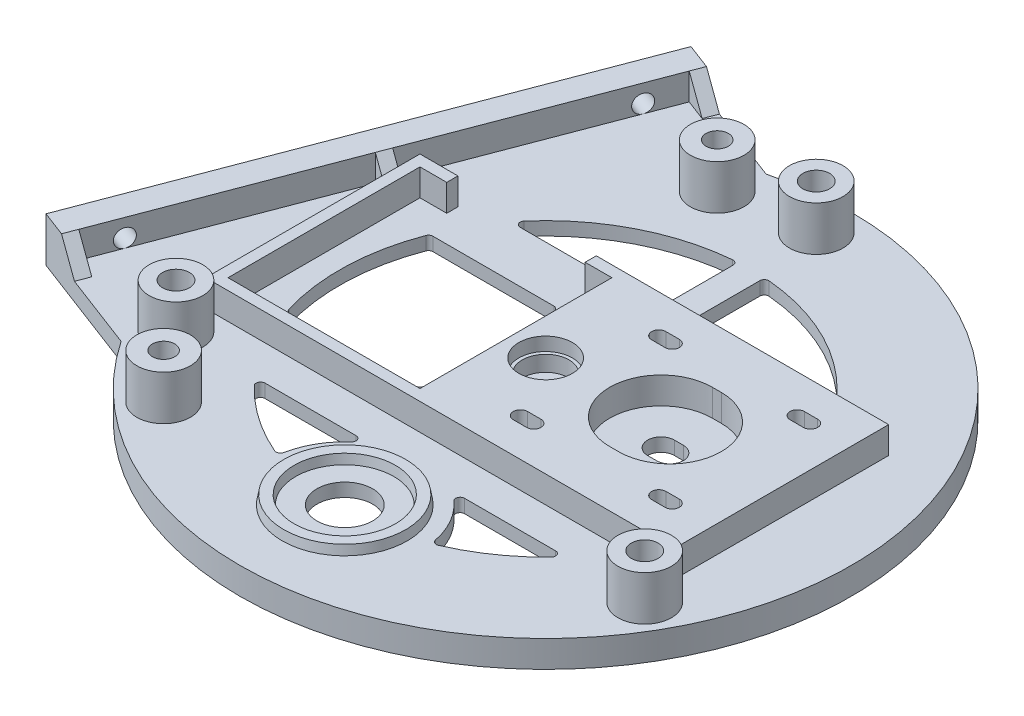
from build123d import *

# Parameters (mm, degrees)
SKETCH2_R           = 6
SKETCH2_R_2         = 3
SKETCH2_R_3         = 2.5
BOSS_EXTRUDE1_DEPTH = 10
SKETCH3_R           = 6.25
CUT_EXTRUDE1_DEPTH  = 10
BOSS_EXTRUDE5_START = -4
BOSS_EXTRUDE5_DEPTH = 4
SKETCH4_R           = 14
SKETCH4_R_2         = 11
BOSS_EXTRUDE2_DEPTH = 2
BOSS_EXTRUDE2_DRAFT = 10
BOSS_EXTRUDE3_DEPTH = 6
CUT_EXTRUDE2_DEPTH  = 115.547023297
CUT_EXTRUDE3_DEPTH  = 115.127212119
SKETCH8_R           = 1.75
CUT_EXTRUDE4_DEPTH  = 115.547023297
CHAMFER1_SIZE       = 2
SKETCH9_R           = 5.25
CUT_EXTRUDE5_DEPTH  = 6.5
SKETCH10_R          = 6
CUT_EXTRUDE6_DEPTH  = 3
CUT_EXTRUDE7_DEPTH  = 115.127212119
SKETCH13_R          = 2
CUT_EXTRUDE8_DEPTH  = 10
RIB1_REACH          = 158.729
SKETCH15_WALL_W     = 323.267375012
SKETCH15_WALL_H     = 3
LPATTERN1_COUNT     = 3
LPATTERN1_PITCH     = 54.5


with BuildPart() as part:
    # Sketch1 → Revolve1 (revolve)
    with BuildSketch(Plane.XY):
        with BuildLine():
            Line((0, 0), (68.5, 0))
            Line((68.5, 0), (68.5, -6))
            Line((68.5, -6), (66.5, -6))
            Line((66.5, -6), (66.5, -3))
            Line((66.5, -3), (62.351595203, -3))
            ThreePointArc((62.351595203, -3), (60, -2.3), (57.648404797, -3))
            Line((57.648404797, -3), (53.5, -3))
            Line((53.5, -3), (53.5, -6))
            Line((53.5, -6), (50.5, -6))
            Line((50.5, -6), (50.5, -3))
            Line((50.5, -3), (8, -3))
            Line((8, -3), (8, -8))
            Line((8, -8), (0, -8))
            Line((0, -8), (0, 0))
        make_face()
    revolve(axis=Axis((0, -8, 0), (0, 1, 0)))

    # Sketch2 → Boss-Extrude1 (add)
    # profile 1 of 5: a face of its own
    with BuildSketch(Plane(origin=(0, 0, 0), x_dir=(1, 0, 0), z_dir=(0, 1, 0))):
        with Locations((0, 60.621778265)):
            Circle(SKETCH2_R)
        with Locations((0, 60.621778265)):
            Circle(SKETCH2_R_2, mode=Mode.SUBTRACT)
    # profile 2 of 5: a face of its own
    with BuildSketch(Plane(origin=(0, 0, 0), x_dir=(1, 0, 0), z_dir=(0, 1, 0))):
        with Locations((52.5, -30.310889132)):
            Circle(SKETCH2_R)
        with Locations((52.5, -30.310889132)):
            Circle(SKETCH2_R_2, mode=Mode.SUBTRACT)
    # profile 3 of 5: a face of its own
    with BuildSketch(Plane(origin=(0, 0, 0), x_dir=(1, 0, 0), z_dir=(0, 1, 0))):
        with Locations((-52.5, -30.310889132)):
            Circle(SKETCH2_R)
        with Locations((-52.5, -30.310889132)):
            Circle(SKETCH2_R_2, mode=Mode.SUBTRACT)
    # profile 4 of 5: a face of its own
    with BuildSketch(Plane(origin=(0, 0, 0), x_dir=(1, 0, 0), z_dir=(0, 1, 0))):
        with Locations((-40.273109217, -45.310889132)):
            Circle(SKETCH2_R)
        with Locations((-40.273109217, -45.310889132)):
            Circle(SKETCH2_R_3, mode=Mode.SUBTRACT)
    # profile 5 of 5: a face of its own
    with BuildSketch(Plane(origin=(0, 0, 0), x_dir=(1, 0, 0), z_dir=(0, 1, 0))):
        with Locations((-19.103826448, 57.532980238)):
            Circle(SKETCH2_R)
        with Locations((-19.103826448, 57.532980238)):
            Circle(SKETCH2_R_3, mode=Mode.SUBTRACT)
    extrude(amount=BOSS_EXTRUDE1_DEPTH)

    # Sketch3 → Cut-Extrude1 (cut)
    with BuildSketch(Plane(origin=(0, 0, 0), x_dir=(1, 0, 0), z_dir=(0, 1, 0))):
        with Locations((0, -45)):
            Circle(SKETCH3_R)
    extrude(amount=-CUT_EXTRUDE1_DEPTH, mode=Mode.SUBTRACT)

    # Sketch12 → Boss-Extrude5 (add)
    with BuildSketch(Plane(origin=(0, 0, 0), x_dir=(1, 0, 0), z_dir=(0, 1, 0)).offset(BOSS_EXTRUDE5_START)):
        with BuildLine():
            Line((-44.128655451, 76.68710301), (-64.028922594, 24.342289775))
            ThreePointArc((-64.028922594, 24.342289775), (-45.626994481, 51.092341643), (-16.974162066, 66.363603143))
            Line((-16.974162066, 66.363603143), (-44.128655451, 76.68710301))
        make_face()
        with BuildLine():
            Line((-83.92918907, -28.002521708), (-56.774695686, -38.326021575))
            ThreePointArc((-56.774695686, -38.326021575), (-68.045630714, -7.876683361), (-64.028922594, 24.342289775))
            Line((-64.028922594, 24.342289775), (-83.92918907, -28.002521708))
        make_face()
    extrude(amount=BOSS_EXTRUDE5_DEPTH)


with BuildPart() as boss_extrude2_tool:
    # Sketch4 → Boss-Extrude2 (with draft: the straight prism first)
    with BuildSketch(Plane(origin=(0, 0, 0), x_dir=(1, 0, 0), z_dir=(0, 1, 0))):
        with Locations((0, -45)):
            Circle(SKETCH4_R)
        with Locations((0, -45)):
            Circle(SKETCH4_R_2, mode=Mode.SUBTRACT)
    extrude(amount=BOSS_EXTRUDE2_DEPTH)
    # Boss-Extrude2: the draft: its side faces are tilted about the plane it starts from
    boss_extrude2_sides = [boss_extrude2_tool.faces().sort_by_distance(p)[0] for p in [
        (-14, 1, 45),
        (-11, 1, 45),
    ]]
    draft(boss_extrude2_sides, Plane(origin=(0, 0, 0), x_dir=(1, 0, 0), z_dir=(0, 1, 0)), BOSS_EXTRUDE2_DRAFT)


with BuildPart() as part_1:
    add(part.part)

    # Boss-Extrude2: add boss_extrude2_tool
    add(boss_extrude2_tool.part)

    # Sketch5 → Boss-Extrude3 (add)
    # profile 1 of 2: a face of its own
    with BuildSketch(Plane(origin=(0, 0, 0), x_dir=(1, 0, 0), z_dir=(0, 1, 0))):
        Polygon((51.356277967, -22.510312898), (51.356277967, 25.489687102), (-14.143722033, 25.489687102), (-14.143722033, 22.989687102), (-8.143722033, 22.989687102), (-8.143722033, -20.010312898), (-51.143722033, -20.010312898), (-51.143722033, 22.989687102), (-45.143722033, 22.989687102), (-45.143722033, 25.489687102), (-53.643722033, 25.489687102), (-53.643722033, -22.510312898), align=None)
        with BuildLine():
            Line((26.356277967, -10.010312898), (24.356277967, -10.010312898))
            ThreePointArc((24.356277967, -10.010312898), (12.856277967, 1.489687102), (24.356277967, 12.989687102))
            Line((24.356277967, 12.989687102), (26.356277967, 12.989687102))
            ThreePointArc((26.356277967, 12.989687102), (37.856277967, 1.489687102), (26.356277967, -10.010312898))
        make_face(mode=Mode.SUBTRACT)
    # profile 2 of 2: a face of its own
    with BuildSketch(Plane(origin=(0, 0, 0), x_dir=(1, 0, 0), z_dir=(0, 1, 0))):
        Polygon((-38.520282698, 74.554931566), (-78.320816318, -30.134693152), (-83.92918907, -28.002521708), (-44.128655451, 76.68710301), align=None)
    extrude(amount=BOSS_EXTRUDE3_DEPTH)

    # Sketch6 → Cut-Extrude2 (cut, through all)
    with BuildSketch(Plane(origin=(0, 6, 0), x_dir=(1, 0, 0), z_dir=(0, 1, 0))):
        with BuildLine():
            Line((11.356277967, -15.610312898), (8.356277967, -15.610312898))
            ThreePointArc((8.356277967, -15.610312898), (6.756277967, -14.010312898), (8.356277967, -12.410312898))
            Line((8.356277967, -12.410312898), (11.356277967, -12.410312898))
            ThreePointArc((11.356277967, -12.410312898), (12.956277967, -14.010312898), (11.356277967, -15.610312898))
        make_face()
        with BuildLine():
            Line((42.356277967, -15.610312898), (39.356277967, -15.610312898))
            ThreePointArc((39.356277967, -15.610312898), (37.756277967, -14.010312898), (39.356277967, -12.410312898))
            Line((39.356277967, -12.410312898), (42.356277967, -12.410312898))
            ThreePointArc((42.356277967, -12.410312898), (43.956277967, -14.010312898), (42.356277967, -15.610312898))
        make_face()
        with BuildLine():
            Line((42.356277967, 15.389687102), (39.356277967, 15.389687102))
            ThreePointArc((39.356277967, 15.389687102), (37.756277967, 16.989687102), (39.356277967, 18.589687102))
            Line((39.356277967, 18.589687102), (42.356277967, 18.589687102))
            ThreePointArc((42.356277967, 18.589687102), (43.956277967, 16.989687102), (42.356277967, 15.389687102))
        make_face()
        with BuildLine():
            Line((11.356277967, 15.389687102), (8.356277967, 15.389687102))
            ThreePointArc((8.356277967, 15.389687102), (6.756277967, 16.989687102), (8.356277967, 18.589687102))
            Line((8.356277967, 18.589687102), (11.356277967, 18.589687102))
            ThreePointArc((11.356277967, 18.589687102), (12.956277967, 16.989687102), (11.356277967, 15.389687102))
        make_face()
    extrude(amount=-CUT_EXTRUDE2_DEPTH, mode=Mode.SUBTRACT)

    # Sketch7 → Cut-Extrude3 (cut, through all)
    with BuildSketch(Plane(origin=(0, 0, 0), x_dir=(1, 0, 0), z_dir=(0, 1, 0))):
        with BuildLine():
            Line((26.356277967, -1.510312898), (24.356277967, -1.510312898))
            ThreePointArc((24.356277967, -1.510312898), (21.356277967, 1.489687102), (24.356277967, 4.489687102))
            Line((24.356277967, 4.489687102), (26.356277967, 4.489687102))
            ThreePointArc((26.356277967, 4.489687102), (29.356277967, 1.489687102), (26.356277967, -1.510312898))
        make_face()
    extrude(amount=-CUT_EXTRUDE3_DEPTH, mode=Mode.SUBTRACT)

    # Sketch8 → Cut-Extrude4 (cut, through all)
    with BuildSketch(Plane(origin=(0, 6, 0), x_dir=(1, 0, 0), z_dir=(0, 1, 0))):
        Circle(SKETCH8_R)
    extrude(amount=-CUT_EXTRUDE4_DEPTH, mode=Mode.SUBTRACT)

    # Chamfer1
    chamfer1_edges = [part_1.edges().sort_by_distance(p)[0] for p in [
        (37.756277967, -3, 14.010312898),
        (40.856277967, -3, 12.410312898),
        (40.856277967, -3, 15.610312898),
        (43.956277967, -3, 14.010312898),
        (37.756277967, -3, -16.989687102),
        (40.856277967, -3, -18.589687102),
        (40.856277967, -3, -15.389687102),
        (43.956277967, -3, -16.989687102),
        (6.756277967, -3, -16.989687102),
        (9.856277967, -3, -18.589687102),
        (9.856277967, -3, -15.389687102),
        (12.956277967, -3, -16.989687102),
        (6.756277967, -3, 14.010312898),
        (9.856277967, -3, 12.410312898),
        (9.856277967, -3, 15.610312898),
        (12.956277967, -3, 14.010312898),
    ]]
    chamfer(chamfer1_edges, length=CHAMFER1_SIZE)

    # Sketch9 → Cut-Extrude5 (cut)
    with BuildSketch(Plane(origin=(0, 6, 0), x_dir=(1, 0, 0), z_dir=(0, 1, 0))):
        Circle(SKETCH9_R)
    extrude(amount=-CUT_EXTRUDE5_DEPTH, mode=Mode.SUBTRACT)

    # Sketch10 → Cut-Extrude6 (cut)
    with BuildSketch(Plane(origin=(0, 6, 0), x_dir=(1, 0, 0), z_dir=(0, 1, 0))):
        Circle(SKETCH10_R)
    extrude(amount=-CUT_EXTRUDE6_DEPTH, mode=Mode.SUBTRACT)

    # Sketch11 → Cut-Extrude7 (cut, through all)
    with BuildSketch(Plane(origin=(0, 0, 0), x_dir=(1, 0, 0), z_dir=(0, 1, 0))):
        with BuildLine():
            Line((-14.143722033, -13.010312898), (-14.143722033, 15.989687102))
            ThreePointArc((-14.143722033, 15.989687102), (-14.436615252, 16.696793883), (-15.143722033, 16.989687102))
            Line((-15.143722033, 16.989687102), (-42.243050857, 16.989687102))
            ThreePointArc((-42.243050857, 16.989687102), (-42.811379545, 16.81248872), (-43.178294385, 16.343692106))
            ThreePointArc((-43.178294385, 16.343692106), (-46.13996215, 1.607877625), (-44.211255475, -13.2983558))
            ThreePointArc((-44.211255475, -13.2983558), (-43.850277349, -13.812822369), (-43.253637969, -14.010312898))
            Line((-43.253637969, -14.010312898), (-15.143722033, -14.010312898))
            ThreePointArc((-15.143722033, -14.010312898), (-14.436615252, -13.717419679), (-14.143722033, -13.010312898))
        make_face()
        with BuildLine():
            Line((3, 29.489687102), (3, 44.990503879))
            ThreePointArc((3, 44.990503879), (3.324929016, 45.72825666), (4.088558332, 45.986574871))
            ThreePointArc((4.088558332, 45.986574871), (21.074922748, 41.077110522), (34.970079512, 30.142576476))
            ThreePointArc((34.970079512, 30.142576476), (35.121716268, 29.073087398), (34.212626235, 28.489687102))
            Line((34.212626235, 28.489687102), (4, 28.489687102))
            ThreePointArc((4, 28.489687102), (3.292893219, 28.782580321), (3, 29.489687102))
        make_face()
        with BuildLine():
            Line((-3, 29.489687102), (-3, 44.990503879))
            ThreePointArc((-3, 44.990503879), (-3.324929016, 45.72825666), (-4.088558332, 45.986574871))
            ThreePointArc((-4.088558332, 45.986574871), (-21.074922748, 41.077110522), (-34.970079512, 30.142576476))
            ThreePointArc((-34.970079512, 30.142576476), (-35.121716268, 29.073087398), (-34.212626235, 28.489687102))
            Line((-34.212626235, 28.489687102), (-4, 28.489687102))
            ThreePointArc((-4, 28.489687102), (-3.292893219, 28.782580321), (-3, 29.489687102))
        make_face()
        with BuildLine():
            Line((-32.554165033, -30.310889132), (-12.146264233, -30.310889132))
            ThreePointArc((-12.146264233, -30.310889132), (-11.211384175, -30.955925362), (-11.482567133, -32.058890576))
            ThreePointArc((-11.482567133, -32.058890576), (-15.012196927, -36.400255555), (-16.971716901, -41.641058721))
            ThreePointArc((-16.971716901, -41.641058721), (-17.487961186, -42.332364065), (-18.350154163, -42.364527848))
            ThreePointArc((-18.350154163, -42.364527848), (-26.327194919, -37.925719312), (-33.27490067, -32.004099159))
            ThreePointArc((-33.27490067, -32.004099159), (-33.474276447, -30.919232412), (-32.554165033, -30.310889132))
        make_face()
        with BuildLine():
            Line((12.146264233, -30.310889132), (32.554165033, -30.310889132))
            ThreePointArc((32.554165033, -30.310889132), (33.474276447, -30.919232412), (33.27490067, -32.004099159))
            ThreePointArc((33.27490067, -32.004099159), (26.327194919, -37.925719312), (18.350154163, -42.364527848))
            ThreePointArc((18.350154163, -42.364527848), (17.487961186, -42.332364065), (16.971716901, -41.641058721))
            ThreePointArc((16.971716901, -41.641058721), (15.012196927, -36.400255555), (11.482567133, -32.058890576))
            ThreePointArc((11.482567133, -32.058890576), (11.211384175, -30.955925362), (12.146264233, -30.310889132))
        make_face()
    extrude(amount=-CUT_EXTRUDE7_DEPTH, mode=Mode.SUBTRACT)

    # Sketch13 → Cut-Extrude8 (cut)
    with BuildSketch(Plane(origin=(-64.028922261, 0, -24.342290651), x_dir=(-0.35536190731935663, 0, 0.934728792124405), z_dir=(-0.9347287921244051, 0, -0.35536190731935663))):
        with Locations((-45, 2)):
            Circle(SKETCH13_R)
        with Locations((45, 2)):
            Circle(SKETCH13_R)
    extrude(amount=-CUT_EXTRUDE8_DEPTH, mode=Mode.SUBTRACT)

    # Sketch15 wall → Rib1 (add, up to next)
    with BuildSketch(Plane(origin=(-75.983994338, 3, 31.02309792), x_dir=(0.598398790677, -0.768221279588, 0.227497149222), z_dir=(0.718078548754, 0.640184399675, 0.272996579158)), mode=Mode.PRIVATE) as rib1_sk1:
        with Locations((0, 1.5)):
            Rectangle(SKETCH15_WALL_W, SKETCH15_WALL_H)
    rib1_tool1 = extrude(rib1_sk1.sketch, amount=-RIB1_REACH, mode=Mode.PRIVATE) - part_1.part
    rib1 = rib1_tool1.solids().sort_by_distance((-75.983994338, 3, 31.02309792))[0]
    add(rib1)

    # LPattern1: Rib1 ×3
    with Locations(*[Vector(0.35536190731935635, 0, -0.9347287921244051) * (i * LPATTERN1_PITCH) for i in range(1, LPATTERN1_COUNT)]):
        add(rib1)


solid = part_1.part
